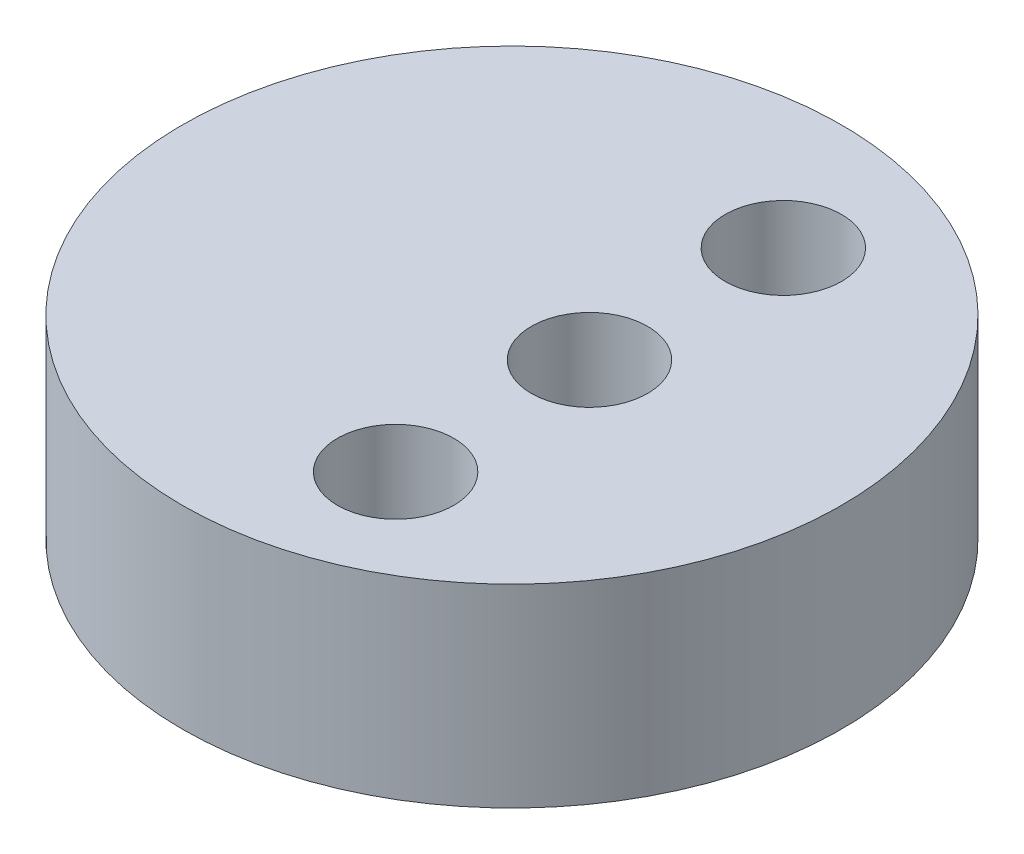
from build123d import *

# Parameters (mm, degrees)
SKETCH1_R           = 8.5
SKETCH1_R_2         = 1.5
BOSS_EXTRUDE1_DEPTH = 5


with BuildPart() as part:
    # Sketch1 → Boss-Extrude1 (new body)
    with BuildSketch(Plane(origin=(0, 0, 0), x_dir=(1, 0, 0), z_dir=(0, 1, 0))):
        with Locations((-2, 0)):
            Circle(SKETCH1_R)
        Circle(SKETCH1_R_2, mode=Mode.SUBTRACT)
        with Locations((0, 5)):
            Circle(SKETCH1_R_2, mode=Mode.SUBTRACT)
        with Locations((0, -5)):
            Circle(SKETCH1_R_2, mode=Mode.SUBTRACT)
    extrude(amount=BOSS_EXTRUDE1_DEPTH)


solid = part.part
